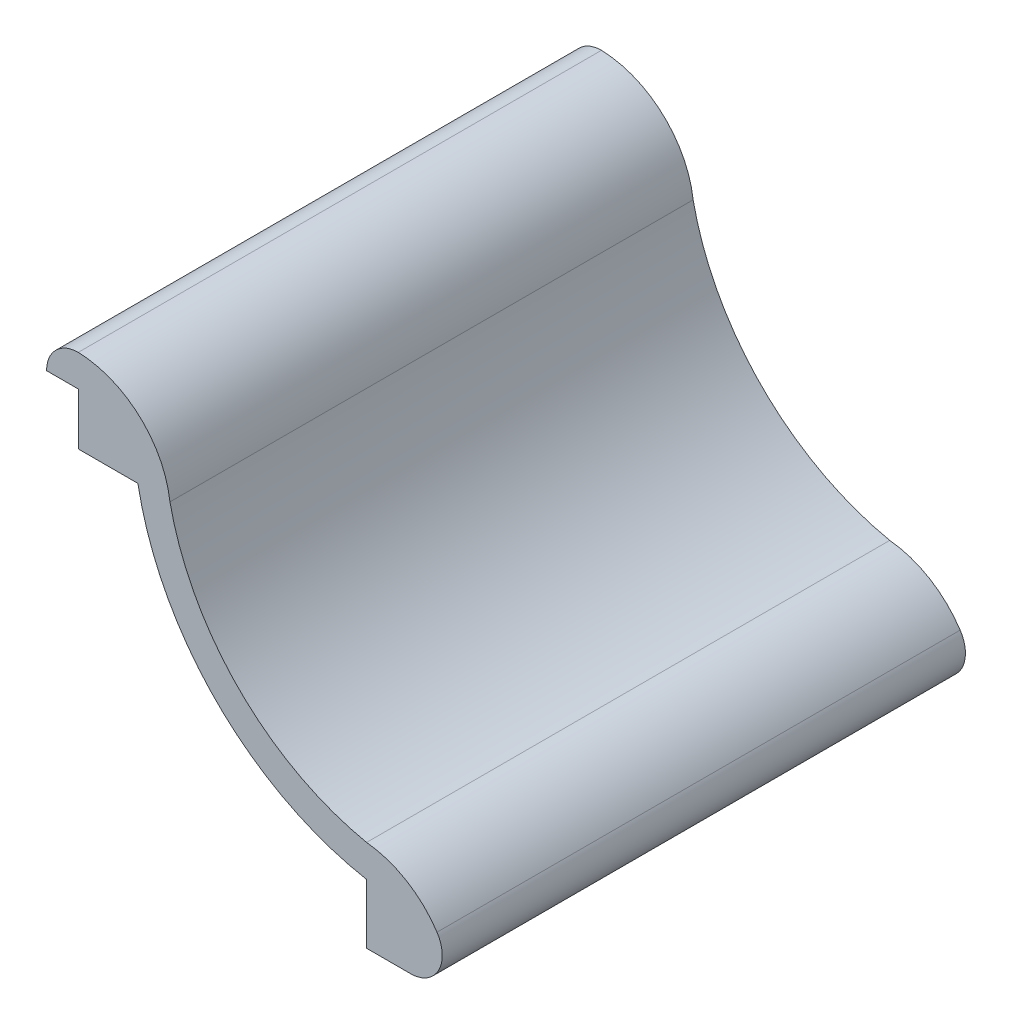
from build123d import *

# Parameters (mm, degrees)
BOSS_EXTRUDE1_DEPTH = 104.775
BOSS_EXTRUDE2_DEPTH = 92.5957
BOSS_EXTRUDE3_START = -5.8293
BOSS_EXTRUDE3_DEPTH = 5.8293
BOSS_EXTRUDE4_DEPTH = 6.35
SKETCH5_W           = 7.787485422
SKETCH5_H           = 19.833751934
SKETCH5_W_2         = 22.754058967
SKETCH5_H_2         = 3.407024872
CUT_EXTRUDE1_DEPTH  = 227.312030137
SKETCH7_W           = 89.459387911
SKETCH7_H           = 93.108081787
CUT_EXTRUDE3_DEPTH  = 104.775
SKETCH8_W           = 104.775
SKETCH8_H           = 6.354337814
BOSS_EXTRUDE5_DEPTH = 6.35
FILLET1_R           = 6.35


with BuildPart() as part:
    # Sketch1 → Boss-Extrude1 (new, symmetric)
    with BuildSketch(Plane.XY):
        with BuildLine():
            Line((-58.2422, 56.2102), (-58.2422, 62.5602))
            ThreePointArc((-58.2422, 62.5602), (-45.640852469, 57.743322347), (-39.3748699, 45.7962))
            ThreePointArc((-39.3748699, 45.7962), (-25.556268964, 20.239931036), (0, 6.4213301))
            ThreePointArc((0, 6.4213301), (12.247457496, 0.293755183), (17.272, -12.446))
            Line((17.272, -12.446), (10.922, -12.446))
            ThreePointArc((10.922, -12.446), (7.760938146, -4.204686933), (0, 0))
            ThreePointArc((0, 0), (-30.011530905, 15.784669095), (-45.7962, 45.7962))
            ThreePointArc((-45.7962, 45.7962), (-50.144819563, 53.243313205), (-58.2422, 56.2102))
        make_face()
    extrude(amount=BOSS_EXTRUDE1_DEPTH, both=True)


with BuildPart() as boss_extrude2_tool:
    # Sketch2 → Boss-Extrude2 (new, symmetric)
    with BuildSketch(Plane.XY):
        with BuildLine():
            Line((-58.2422, 56.2102), (-58.2422, 45.796198296))
            Line((-58.2422, 45.796198296), (-45.796199685, 45.796198296))
            ThreePointArc((-45.796199685, 45.796198296), (-50.144818899, 53.243312648), (-58.2422, 56.2102))
        make_face()
        with BuildLine():
            Line((0, 0), (0, -12.446))
            Line((0, -12.446), (10.922, -12.446))
            ThreePointArc((10.922, -12.446), (7.760938146, -4.204686933), (0, 0))
        make_face()
    extrude(amount=BOSS_EXTRUDE2_DEPTH, both=True)


with BuildPart() as part_1:
    add(part.part)


with BuildPart() as part_2:
    # Boss-Extrude2: joined with boss_extrude2_tool
    add(part_1.part.fuse(boss_extrude2_tool.part, tol=0.00001))

    # Sketch3 → Boss-Extrude3 (add)
    with BuildSketch(Plane(origin=(0, 0, -104.775), x_dir=(-1, 0, 0), z_dir=(0, 0, -1)).offset(BOSS_EXTRUDE3_START)):
        with BuildLine():
            Line((58.2422, 56.2102), (58.2422, 45.796198296))
            Line((58.2422, 45.796198296), (45.7962, 45.7962))
            ThreePointArc((45.7962, 45.7962), (50.144819563, 53.243313205), (58.2422, 56.2102))
        make_face()
        with BuildLine():
            Line((0, 0), (0, -12.446))
            Line((0, -12.446), (-10.922, -12.446))
            ThreePointArc((-10.922, -12.446), (-7.760938146, -4.204686933), (0, 0))
        make_face()
    extrude(amount=BOSS_EXTRUDE3_DEPTH)

    # Sketch4 → Boss-Extrude4 (add)
    with BuildSketch(Plane.XY.offset(104.775)):
        with BuildLine():
            Line((-58.2422, 56.2102), (-58.2422, 45.796198296))
            Line((-58.2422, 45.796198296), (-45.7962, 45.7962))
            ThreePointArc((-45.7962, 45.7962), (-50.144819563, 53.243313205), (-58.2422, 56.2102))
        make_face()
        with BuildLine():
            Line((0, 0), (0, -12.446))
            Line((0, -12.446), (10.922, -12.446))
            ThreePointArc((10.922, -12.446), (7.760938146, -4.204686933), (0, 0))
        make_face()
    extrude(amount=-BOSS_EXTRUDE4_DEPTH)

    # Sketch5 → Cut-Extrude1 (cut, through all)
    with BuildSketch(Plane.XY.offset(104.775)):
        with Locations((-61.627942711, 54.680509116)):
            Rectangle(SKETCH5_W, SKETCH5_H)
        with Locations((8.225058429, -13.641512436)):
            Rectangle(SKETCH5_W_2, SKETCH5_H_2)
    extrude(amount=-CUT_EXTRUDE1_DEPTH, mode=Mode.SUBTRACT)

    # Sketch7 → Cut-Extrude3 (cut)
    with BuildSketch(Plane.XY.offset(104.775)):
        with Locations((-22.903611999, 28.130063449)):
            Rectangle(SKETCH7_W, SKETCH7_H)
    extrude(amount=-CUT_EXTRUDE3_DEPTH, mode=Mode.SUBTRACT)

    # Sketch8 → Boss-Extrude5 (add)
    with BuildSketch(Plane.ZY.offset(57.7342)):
        with Locations((-52.3875, 59.374341949)):
            Rectangle(SKETCH8_W, SKETCH8_H)
    extrude(amount=BOSS_EXTRUDE5_DEPTH)

    # Fillet1
    # the kernel refuses this fillet: 6.35 mm, written as the material it takes off along each edge
    with BuildSketch(Plane(origin=(17.260151367, -11.938, -130.624178653), x_dir=(-0.30497213299383213, 0.9523612749882223, 0), z_dir=(0, 0, 1))) as fillet1_piece_1:
        with BuildLine():
            CenterArc((8.625598356, 6.114282737), FILLET1_R, 162.243512631, 123.416753829)
            Line((2.57810426, 8.050855782), (0, 0))
            ThreePointArc((0, 0), (5.169835731, -0.710949564), (10.339671461, 0))
        make_face()
    extrude(amount=156.473357306, mode=Mode.SUBTRACT)
    with BuildSketch(Plane(origin=(-64.0842, 62.551510856, -120.65), x_dir=(1, 0, 0), z_dir=(0, 0, 1))) as fillet1_piece_2:
        with BuildLine():
            CenterArc((FILLET1_R, -FILLET1_R), FILLET1_R, 90, 90)
            Line((0, -FILLET1_R), (0, 0))
            Line((0, 0), (FILLET1_R, 0))
        make_face()
    extrude(amount=136.525, mode=Mode.SUBTRACT)


solid = part_2.part
